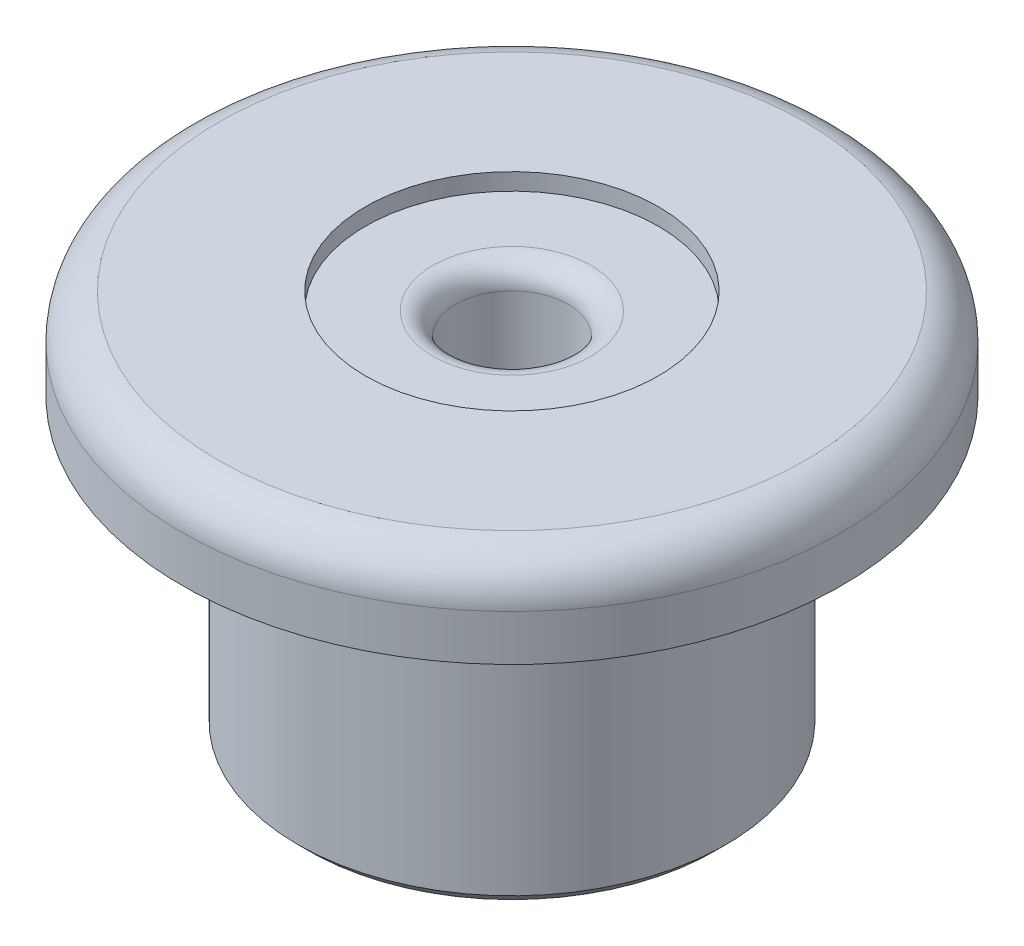
from build123d import *

# Parameters (mm, degrees)
SKETCH2_R          = 6.5
CUT_EXTRUDE1_DEPTH = 0.75
SKETCH3_R          = 2.5
CUT_EXTRUDE2_DEPTH = 65.75
SKETCH5_R          = 3
CUT_EXTRUDE6_DEPTH = 19
CHAMFER1_SIZE      = 0.5
FILLET1_R          = 1


with BuildPart() as part:
    # Sketch1 → Revolve1 (revolve)
    with BuildSketch(Plane.XY, mode=Mode.PRIVATE) as revolve1_sk:
        with BuildLine():
            Line((0, 17), (0, 10.286668621))
            ThreePointArc((0, 10.286668621), (5.42509601, 7.238924157), (7.576230068, 1.4))
            Line((7.576230068, 1.4), (7.576230068, 0))
            Line((7.576230068, 0), (9.5, 0))
            Line((9.5, 0), (9.5, 13))
            Line((9.5, 13), (14.616013263, 13))
            Line((14.616013263, 13), (14.616013263, 15.037207554))
            ThreePointArc((14.616013263, 15.037207554), (14.160029693, 16.308432657), (13, 17))
            Line((13, 17), (0, 17))
        make_face()
    revolve(revolve1_sk.sketch.rotate(Axis((0, 0, 0), (0, 1, 0)), 90), axis=Axis((0, 0, 0), (0, 1, 0)))

    # Sketch2 → Cut-Extrude1 (cut)
    with BuildSketch(Plane(origin=(0, 17, 0), x_dir=(1, 0, 0), z_dir=(0, 1, 0))):
        with Locations(Location((0, 0, 0), (0, 0, 270))):
            Circle(SKETCH2_R)
    extrude(amount=-CUT_EXTRUDE1_DEPTH, mode=Mode.SUBTRACT)

    # Sketch3 → Cut-Extrude2 (cut)
    with BuildSketch(Plane(origin=(0, 16.25, 0), x_dir=(1, 0, 0), z_dir=(0, 1, 0))):
        with Locations(Location((0, 0, 0), (0, 0, 270))):
            Circle(SKETCH3_R)
    extrude(amount=-CUT_EXTRUDE2_DEPTH, mode=Mode.SUBTRACT)

    # Sketch5 → Cut-Extrude6 (cut)
    with BuildSketch(Plane(origin=(0, -8, 0), x_dir=(1, 0, 0), z_dir=(0, 1, 0))):
        with Locations(Location((0, 0, 0), (0, 0, 90))):
            Circle(SKETCH5_R)
    extrude(amount=CUT_EXTRUDE6_DEPTH, mode=Mode.SUBTRACT)

    # Chamfer1
    chamfer1_edges = [part.edges().sort_by_distance(p)[0] for p in [
        (0, 0, 9.5),
    ]]
    chamfer(chamfer1_edges, length=CHAMFER1_SIZE)

    # Fillet1
    # the kernel refuses this fillet: 1 mm, written as the material it adds along each edge
    with BuildSketch(Plane(origin=(0, 11, 0), x_dir=(0, 0, -1), z_dir=(1, 0, 0))) as fillet1_piece_1:
        with BuildLine():
            CenterArc((2, -0.866025404), FILLET1_R, 0, 60)
            Line((2.5, 0), (3, 0))
            Line((3, 0), (3, -0.866025404))
        make_face()
    revolve(axis=Axis((0, 11, 0), (0, 1, 0)))
    # the kernel refuses this fillet: 1 mm, written as the material it takes off along each edge
    with BuildSketch(Plane(origin=(0, 16.25, 0), x_dir=(0, 0, 1), z_dir=(-1, 0, 0))) as fillet1_2_piece_1:
        with BuildLine():
            CenterArc((2.5 + FILLET1_R, -FILLET1_R), FILLET1_R, 90, 90)
            Line((2.5 + FILLET1_R, 0), (2.5, 0))
            Line((2.5, 0), (2.5, -FILLET1_R))
        make_face()
    revolve(axis=Axis((0, 16.25, 0), (0, 1, 0)), mode=Mode.SUBTRACT)


solid = part.part
